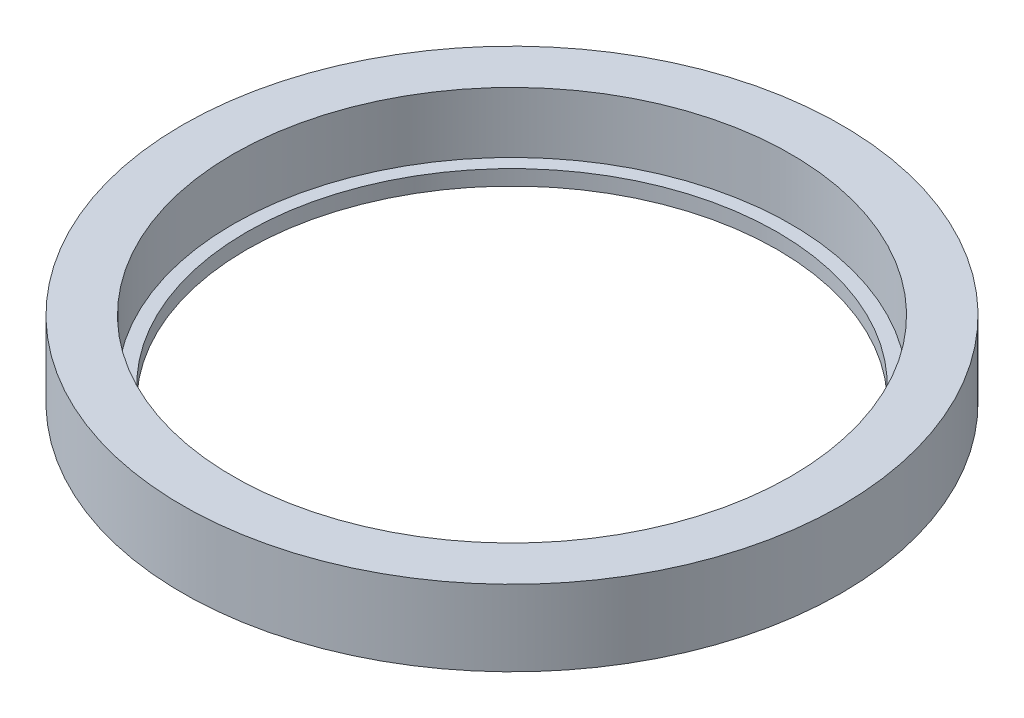
from build123d import *


with BuildPart() as part:
    # Sketch3 → Ring (revolve)
    with BuildSketch(Plane.XY):
        Polygon((-55.2, 11.8), (-65.2, 11.8), (-65.2, -3.2), (-52.5, -3.2), (-52.5, -0.2), (-55.2, -0.2), align=None)
    revolve(axis=Axis((0, 0, 0), (0, 1, 0)))


solid = part.part
